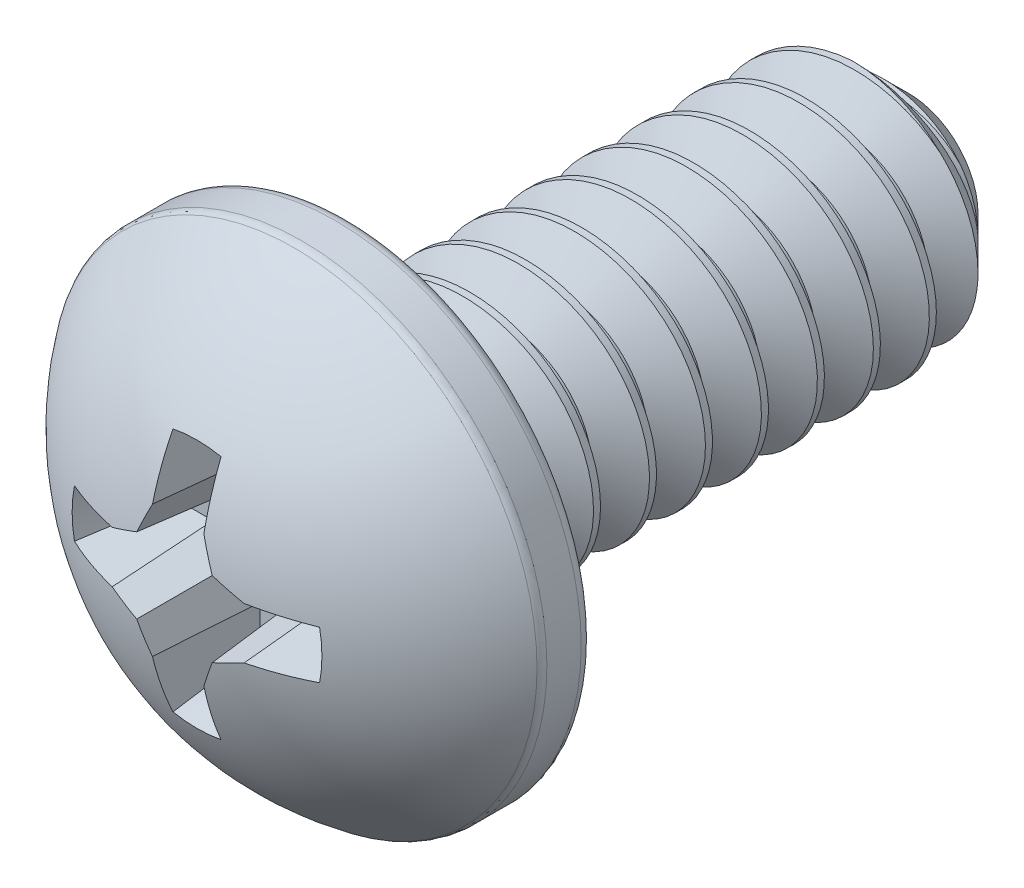
from build123d import *

# Parameters (mm, degrees)
CUT_EXTRUDE1_DEPTH = 1.2191999999999998
DRAFT1_ANGLE       = 15.000000000000034
DRAFT2_ANGLE       = 5.000000000000011
CUT_SWEEP1_PITCH   = 0.6349999999999941


# Read off the part's stored shape, not the designer's step: Split1, Boss-Extrude1
with BuildPart() as part:
    # Sketch2 → Revolve1 (revolve)
    with BuildSketch(Plane(origin=(0, 0, 0), x_dir=(0, 0, -1), z_dir=(1, 0, 0)), mode=Mode.PRIVATE) as revolve1_sk:
        with BuildLine():
            Line((4.191000000000001, -1.8e-16), (4.1909999999999865, 0.7874000000000236))
            Line((4.1909999999999865, 0.7874000000000236), (3.55599999999999, 1.4224000000000008))
            Line((3.55599999999999, 1.4224000000000008), (-2.1589999999999945, 1.4223999999999999))
            Line((-2.1589999999999945, 1.4223999999999999), (-2.1589999999999945, 2.636157142857143))
            ThreePointArc((-2.1589999999999945, 2.636157142857143), (-2.2015113586163473, 2.7387886413836475), (-2.304142857142852, 2.7813000000000003))
            Line((-2.304142857142852, 2.7813000000000003), (-2.6934201181806894, 2.7813000000000003))
            ThreePointArc((-2.6934201181806894, 2.7813000000000003), (-2.7378876554243425, 2.7743204053804207), (-2.7780785043100416, 2.7540528876385677))
            ThreePointArc((-2.7780785043100416, 2.7540528876385677), (-3.817159913894459, 1.5476719985911969), (-4.191000000000001, -1.8e-16))
            Line((-4.191000000000001, -1.8e-16), (4.191000000000001, -1.8e-16))
        make_face()
    revolve(revolve1_sk.sketch.rotate(Axis((0, -1.8e-16, 4.191000000000001), (0, 0, -1)), 90), axis=Axis((0, -1.8e-16, 4.191000000000001), (0, 0, -1)))

    # Sketch3 → Cut-Extrude1 (cut)
    with BuildSketch(Plane.XY.offset(4.191000000000001)):
        with BuildLine():
            Line((0.29999999999999916, 0.7500000000000101), (0.4318019484660533, 0.43180194846605024))
            Line((0.4318019484660533, 0.43180194846605024), (0.7500000000000122, 0.2999999999999938))
            Line((0.7500000000000122, 0.2999999999999938), (1.4696938456699327, 0.29999999999999377))
            ThreePointArc((1.4696938456699327, 0.29999999999999377), (1.500000000000024, 3e-17), (1.4696938456699327, -0.29999999999999377))
            Line((1.4696938456699327, -0.29999999999999377), (0.7500000000000122, -0.2999999999999938))
            Line((0.7500000000000122, -0.2999999999999938), (0.4318019484660533, -0.43180194846605024))
            Line((0.4318019484660533, -0.43180194846605024), (0.29999999999999916, -0.7500000000000101))
            Line((0.29999999999999916, -0.7500000000000101), (0.2999999999999991, -1.4696938456699307))
            ThreePointArc((0.2999999999999991, -1.4696938456699307), (9e-17, -1.500000000000023), (-0.2999999999999991, -1.4696938456699307))
            Line((-0.2999999999999991, -1.4696938456699307), (-0.29999999999999916, -0.7500000000000101))
            Line((-0.29999999999999916, -0.7500000000000101), (-0.4318019484660533, -0.43180194846605024))
            Line((-0.4318019484660533, -0.43180194846605024), (-0.7500000000000122, -0.2999999999999938))
            Line((-0.7500000000000122, -0.2999999999999938), (-1.4696938456699327, -0.29999999999999377))
            ThreePointArc((-1.4696938456699327, -0.29999999999999377), (-1.500000000000024, 6.3e-16), (-1.4696938456699327, 0.29999999999999377))
            Line((-1.4696938456699327, 0.29999999999999377), (-0.7500000000000122, 0.2999999999999938))
            Line((-0.7500000000000122, 0.2999999999999938), (-0.4318019484660533, 0.43180194846605024))
            Line((-0.4318019484660533, 0.43180194846605024), (-0.29999999999999916, 0.7500000000000101))
            Line((-0.29999999999999916, 0.7500000000000101), (-0.2999999999999991, 1.4696938456699307))
            ThreePointArc((-0.2999999999999991, 1.4696938456699307), (9e-17, 1.500000000000023), (0.2999999999999991, 1.4696938456699307))
            Line((0.2999999999999991, 1.4696938456699307), (0.29999999999999916, 0.7500000000000101))
        make_face()
    extrude(amount=-CUT_EXTRUDE1_DEPTH, mode=Mode.SUBTRACT)

    # Draft1
    draft1_faces = [part.faces().sort_by_distance(p)[0] for p in [
        (1.5000000000000242, 0, 3.4064726121450093),
        (1e-17, 1.500000000000023, 3.4064726121450115),
        (1e-17, -1.500000000000023, 3.406472612145012),
        (-1.500000000000024, 1e-17, 3.4064726121450133),
    ]]
    draft(draft1_faces, Plane.XY.offset(4.191000000000001), DRAFT1_ANGLE)

    # Draft2
    draft2_faces = [part.faces().sort_by_distance(p)[0] for p in [
        (0.29999999999999916, 1.0047534515352026, 3.531992051469458),
        (1.0047534515352043, -0.2999999999999938, 3.5319920514694565),
        (0.29999999999999916, -1.0047534515343541, 3.531992051464732),
        (-0.29999999999999916, -1.0047534515352028, 3.5319920514694587),
        (-1.0047534512648975, -0.2999999999999938, 3.531992049963959),
        (-1.0047534515352037, 0.2999999999999938, 3.5319920514694583),
        (-0.29999999999999916, 1.0047534511506853, 3.531992049327858),
        (1.0047534515352021, 0.2999999999999938, 3.531992051469442),
        (0.5899251850174535, 0.36630515936013236, 3.544709838156921),
        (0.3663051593601366, 0.5899251850174508, 3.5447098381569213),
        (0.5899251850174534, -0.3663051593601324, 3.544709838156921),
        (0.3663051593601365, -0.5899251850174508, 3.5447098381569213),
        (-0.3663051593601366, -0.5899251850174508, 3.544709838156922),
        (-0.5899251850174535, -0.3663051593601324, 3.544709838156923),
        (-0.5899251850174535, 0.36630515936013236, 3.5447098381569226),
        (-0.3663051593601365, 0.5899251850174508, 3.5447098381569218),
    ]]
    draft(draft2_faces, Plane.XY.offset(4.191000000000001), DRAFT2_ANGLE)


with BuildPart() as body_2:
    # Split1: the piece on the far side of the plane
    add(part.part)
    split(bisect_by=Plane.XY.offset(2.159), keep=Keep.BOTTOM)

    # Cut-Sweep1: the profile of Sketch5 screwed along a right-hand helix of 11 turns, 6 arcs to a turn; built about Z, then put on its axis
    cut_sweep1_z = Axis((0, 0, 0), (0, 0, 1))
    cut_sweep1_corners = [(1.456770383, 0, 0.01984375), (1.009955401, 0, -0.238125), (1.009955401, 0, -0.3175), (1.456770383, 0, -0.57546875)]
    with BuildLine(mode=Mode.PRIVATE) as cut_sweep1_profile:
        Line(cut_sweep1_corners[0], cut_sweep1_corners[1])
        Line(cut_sweep1_corners[1], cut_sweep1_corners[2])
        Line(cut_sweep1_corners[2], cut_sweep1_corners[3])
        Line(cut_sweep1_corners[3], cut_sweep1_corners[0])
    cut_sweep1_cap = Face(cut_sweep1_profile.wire())
    cut_sweep1_turn_angles = [0, 30, 60, 90, 120, 150, 180, 210, 240, 270, 300, 330, 360]
    cut_sweep1_turn_weights = [1, 0.8660254037844387, 1, 0.8660254037844387, 1, 0.8660254037844387, 1, 0.8660254037844387, 1, 0.8660254037844387, 1, 0.8660254037844387, 1]
    cut_sweep1_turn_rails = [Edge.make_bspline([Vector(p[0], p[1], 0).rotate(cut_sweep1_z, cut_sweep1_turn_angles[k]) / cut_sweep1_turn_weights[k] + Vector(0, 0, p[2] + CUT_SWEEP1_PITCH * cut_sweep1_turn_angles[k] / 360) for k in range(13)], [0, 0, 0, 1, 1, 2, 2, 3, 3, 4, 4, 5, 5, 6, 6, 6], 2, cut_sweep1_turn_weights) for p in cut_sweep1_corners]
    cut_sweep1_turn_sides = [Face.make_surface_from_curves(cut_sweep1_turn_rails[p[0]], cut_sweep1_turn_rails[p[1]]) for p in [(0, 1), (1, 2), (2, 3), (3, 0)]]
    cut_sweep1_turn = Solid(Shell([*cut_sweep1_turn_sides, cut_sweep1_cap, cut_sweep1_cap.rotate(cut_sweep1_z, 360).moved(Location((0, 0, CUT_SWEEP1_PITCH * 360 / 360)))]))
    cut_sweep1_each = [*[cut_sweep1_turn.moved(Location((0, 0, CUT_SWEEP1_PITCH * i))) for i in range(11)]]
    add(Plane(origin=(0, -7.6e-16, -4.190999999999994), x_dir=(3.49e-15, 1, 0), z_dir=(0, 0, 1)) * Compound([cut_sweep1_each[i] for i in range(0, 11, 2)]), mode=Mode.SUBTRACT)
    add(Plane(origin=(0, -7.6e-16, -4.190999999999994), x_dir=(3.49e-15, 1, 0), z_dir=(0, 0, 1)) * Compound([cut_sweep1_each[i] for i in range(1, 11, 2)]), mode=Mode.SUBTRACT)


with BuildPart() as part_1:
    add(part.part)

    # Split1
    split(bisect_by=Plane.XY.offset(2.159), keep=Keep.TOP)

    add(body_2.part)  # Boss-Extrude1 merges body 2
    # Boss-Extrude1 outline → Boss-Extrude1 (revolve)
    with BuildSketch(Plane.XZ):
        Polygon((1.00995454, 2.159), (1.00995454, 1.025815412), (1.4224, 2.159), align=None)
    revolve(axis=Axis((0, 0, 0), (0, 0, 1)))


solid = part_1.part
